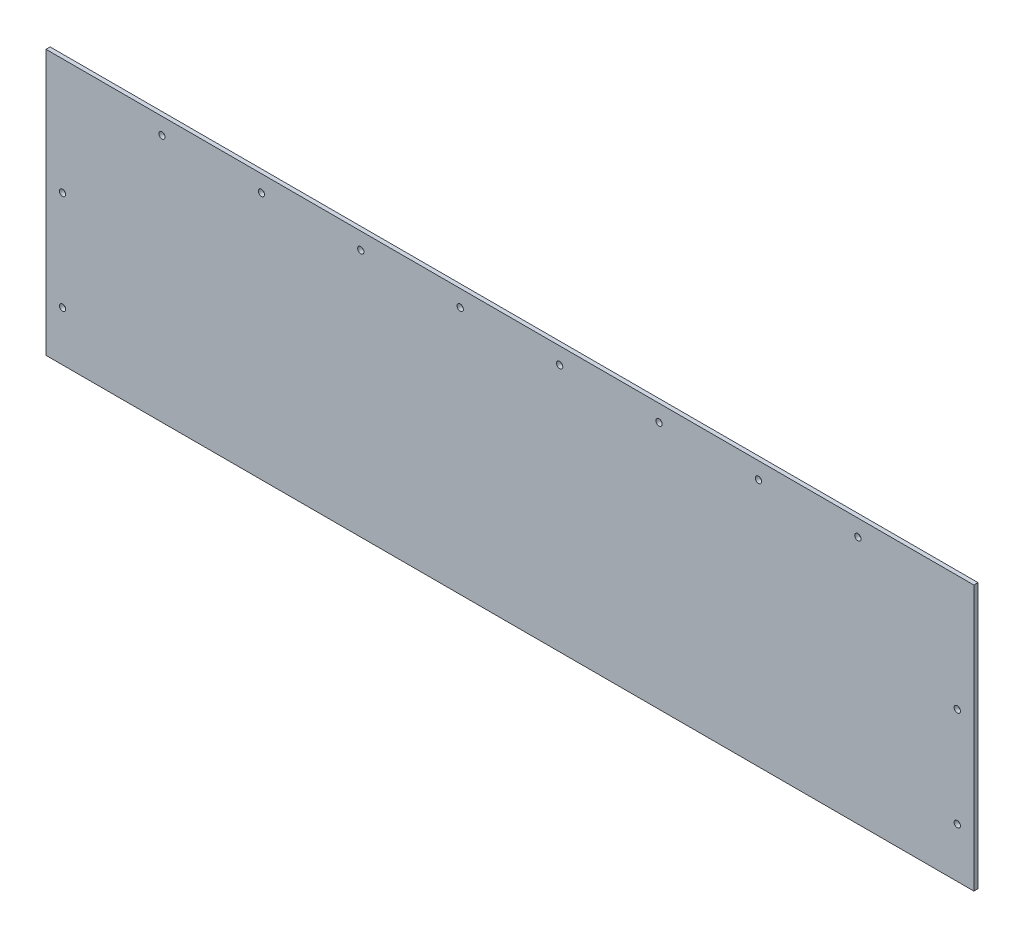
from build123d import *

# Parameters (mm, degrees)
SKETCH1_W           = 711.2
SKETCH1_H           = 203.2
BOSS_EXTRUDE1_DEPTH = 3.175
CUT_EXTRUDE1_REACH  = 741.666
SKETCH2_R           = 2.413


with BuildPart() as part:
    # Sketch1 → Boss-Extrude1 (new body)
    with BuildSketch(Plane.XY):
        with Locations((355.6, 101.6)):
            Rectangle(SKETCH1_W, SKETCH1_H)
    extrude(amount=BOSS_EXTRUDE1_DEPTH)

    # Sketch2 → Cut-Extrude1 (cut, up to next)
    with BuildSketch(Plane.XY.offset(3.175), mode=Mode.PRIVATE) as cut_extrude1_sk1:
        with Locations((12.7, 114.3)):
            Circle(SKETCH2_R)
    cut_extrude1_tool1 = extrude(cut_extrude1_sk1.sketch, amount=-CUT_EXTRUDE1_REACH, mode=Mode.PRIVATE) & part.part
    # Sketch2 → Cut-Extrude1 (cut, up to next)
    with BuildSketch(Plane.XY.offset(3.175), mode=Mode.PRIVATE) as cut_extrude1_sk2:
        with Locations((698.5, 114.3)):
            Circle(SKETCH2_R)
    cut_extrude1_tool2 = extrude(cut_extrude1_sk2.sketch, amount=-CUT_EXTRUDE1_REACH, mode=Mode.PRIVATE) & part.part
    # Sketch2 → Cut-Extrude1 (cut, up to next)
    with BuildSketch(Plane.XY.offset(3.175), mode=Mode.PRIVATE) as cut_extrude1_sk3:
        with Locations((12.7, 38.1)):
            Circle(SKETCH2_R)
    cut_extrude1_tool3 = extrude(cut_extrude1_sk3.sketch, amount=-CUT_EXTRUDE1_REACH, mode=Mode.PRIVATE) & part.part
    # Sketch2 → Cut-Extrude1 (cut, up to next)
    with BuildSketch(Plane.XY.offset(3.175), mode=Mode.PRIVATE) as cut_extrude1_sk4:
        with Locations((698.5, 38.1)):
            Circle(SKETCH2_R)
    cut_extrude1_tool4 = extrude(cut_extrude1_sk4.sketch, amount=-CUT_EXTRUDE1_REACH, mode=Mode.PRIVATE) & part.part
    # Sketch2 → Cut-Extrude1 (cut, up to next)
    with BuildSketch(Plane.XY.offset(3.175), mode=Mode.PRIVATE) as cut_extrude1_sk5:
        with Locations((88.9, 190.5)):
            Circle(SKETCH2_R)
    cut_extrude1_tool5 = extrude(cut_extrude1_sk5.sketch, amount=-CUT_EXTRUDE1_REACH, mode=Mode.PRIVATE) & part.part
    # Sketch2 → Cut-Extrude1 (cut, up to next)
    with BuildSketch(Plane.XY.offset(3.175), mode=Mode.PRIVATE) as cut_extrude1_sk6:
        with Locations((165.1, 190.5)):
            Circle(SKETCH2_R)
    cut_extrude1_tool6 = extrude(cut_extrude1_sk6.sketch, amount=-CUT_EXTRUDE1_REACH, mode=Mode.PRIVATE) & part.part
    # Sketch2 → Cut-Extrude1 (cut, up to next)
    with BuildSketch(Plane.XY.offset(3.175), mode=Mode.PRIVATE) as cut_extrude1_sk7:
        with Locations((241.3, 190.5)):
            Circle(SKETCH2_R)
    cut_extrude1_tool7 = extrude(cut_extrude1_sk7.sketch, amount=-CUT_EXTRUDE1_REACH, mode=Mode.PRIVATE) & part.part
    # Sketch2 → Cut-Extrude1 (cut, up to next)
    with BuildSketch(Plane.XY.offset(3.175), mode=Mode.PRIVATE) as cut_extrude1_sk8:
        with Locations((622.3, 190.5)):
            Circle(SKETCH2_R)
    cut_extrude1_tool8 = extrude(cut_extrude1_sk8.sketch, amount=-CUT_EXTRUDE1_REACH, mode=Mode.PRIVATE) & part.part
    # Sketch2 → Cut-Extrude1 (cut, up to next)
    with BuildSketch(Plane.XY.offset(3.175), mode=Mode.PRIVATE) as cut_extrude1_sk9:
        with Locations((546.1, 190.5)):
            Circle(SKETCH2_R)
    cut_extrude1_tool9 = extrude(cut_extrude1_sk9.sketch, amount=-CUT_EXTRUDE1_REACH, mode=Mode.PRIVATE) & part.part
    # Sketch2 → Cut-Extrude1 (cut, up to next)
    with BuildSketch(Plane.XY.offset(3.175), mode=Mode.PRIVATE) as cut_extrude1_sk10:
        with Locations((469.9, 190.5)):
            Circle(SKETCH2_R)
    cut_extrude1_tool10 = extrude(cut_extrude1_sk10.sketch, amount=-CUT_EXTRUDE1_REACH, mode=Mode.PRIVATE) & part.part
    # Sketch2 → Cut-Extrude1 (cut, up to next)
    with BuildSketch(Plane.XY.offset(3.175), mode=Mode.PRIVATE) as cut_extrude1_sk11:
        with Locations((393.7, 190.5)):
            Circle(SKETCH2_R)
    cut_extrude1_tool11 = extrude(cut_extrude1_sk11.sketch, amount=-CUT_EXTRUDE1_REACH, mode=Mode.PRIVATE) & part.part
    # Sketch2 → Cut-Extrude1 (cut, up to next)
    with BuildSketch(Plane.XY.offset(3.175), mode=Mode.PRIVATE) as cut_extrude1_sk12:
        with Locations((317.5, 190.5)):
            Circle(SKETCH2_R)
    cut_extrude1_tool12 = extrude(cut_extrude1_sk12.sketch, amount=-CUT_EXTRUDE1_REACH, mode=Mode.PRIVATE) & part.part
    add(cut_extrude1_tool1.solids().sort_by_distance((12.7, 114.3, 3.175))[0], mode=Mode.SUBTRACT)
    add(cut_extrude1_tool2.solids().sort_by_distance((698.5, 114.3, 3.175))[0], mode=Mode.SUBTRACT)
    add(cut_extrude1_tool3.solids().sort_by_distance((12.7, 38.1, 3.175))[0], mode=Mode.SUBTRACT)
    add(cut_extrude1_tool4.solids().sort_by_distance((698.5, 38.1, 3.175))[0], mode=Mode.SUBTRACT)
    add(cut_extrude1_tool5.solids().sort_by_distance((88.9, 190.5, 3.175))[0], mode=Mode.SUBTRACT)
    add(cut_extrude1_tool6.solids().sort_by_distance((165.1, 190.5, 3.175))[0], mode=Mode.SUBTRACT)
    add(cut_extrude1_tool7.solids().sort_by_distance((241.3, 190.5, 3.175))[0], mode=Mode.SUBTRACT)
    add(cut_extrude1_tool8.solids().sort_by_distance((622.3, 190.5, 3.175))[0], mode=Mode.SUBTRACT)
    add(cut_extrude1_tool9.solids().sort_by_distance((546.1, 190.5, 3.175))[0], mode=Mode.SUBTRACT)
    add(cut_extrude1_tool10.solids().sort_by_distance((469.9, 190.5, 3.175))[0], mode=Mode.SUBTRACT)
    add(cut_extrude1_tool11.solids().sort_by_distance((393.7, 190.5, 3.175))[0], mode=Mode.SUBTRACT)
    add(cut_extrude1_tool12.solids().sort_by_distance((317.5, 190.5, 3.175))[0], mode=Mode.SUBTRACT)


solid = part.part
